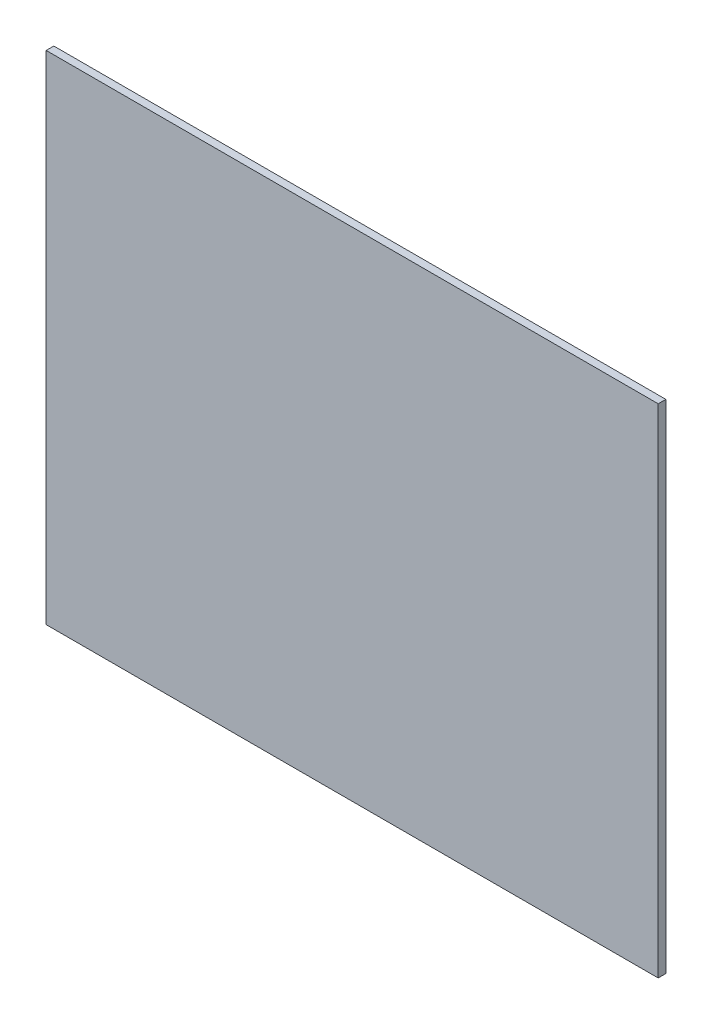
from build123d import *

# Parameters (mm, degrees)
IZIM1_W            = 800
IZIM1_H            = 650
TABAN_FLAN_1_DEPTH = 10


# Sheet-metal steps are written as plain solids
with BuildPart() as part:
    # Çizim1 → Taban-Flanş1 (new body)
    with BuildSketch(Plane.XY):
        Rectangle(IZIM1_W, IZIM1_H)
    extrude(amount=-TABAN_FLAN_1_DEPTH)


solid = part.part
